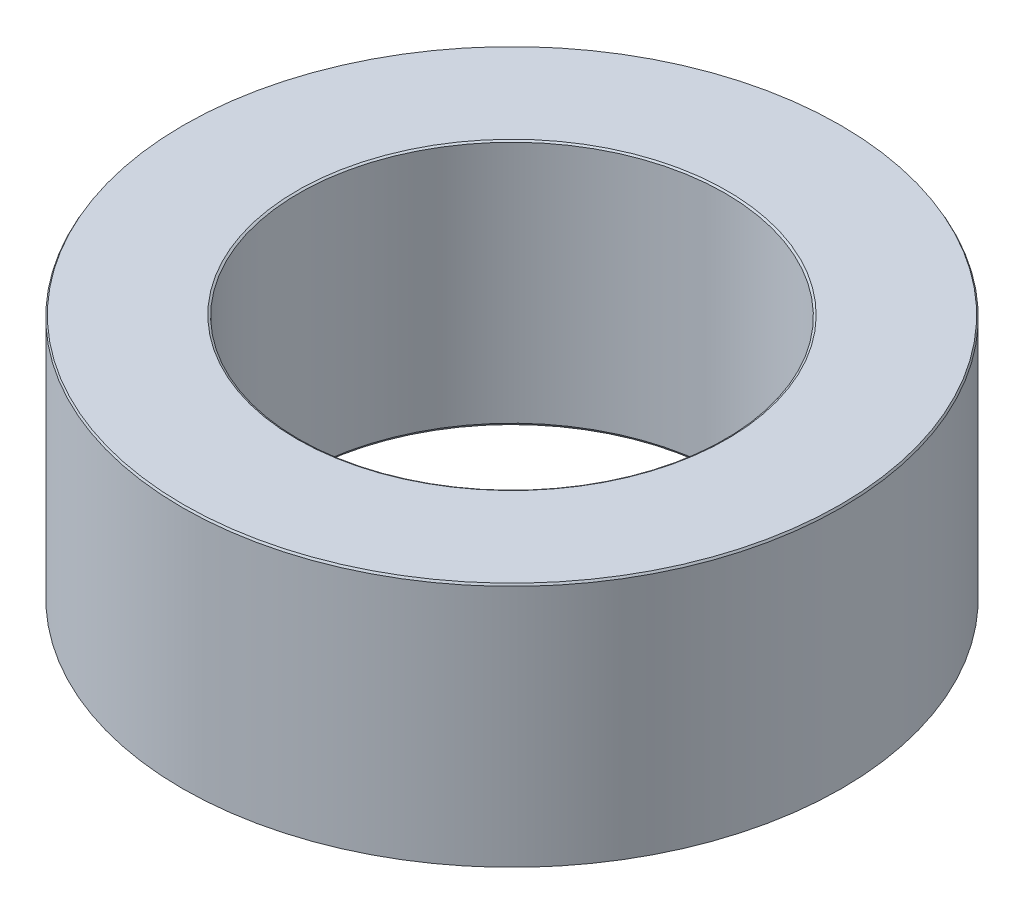
from build123d import *
from OCP.BRepFilletAPI import BRepFilletAPI_MakeChamfer

# Parameters (mm, degrees)
SKETCH1_R           = 57.5
BOSS_EXTRUDE1_DEPTH = 42.985384043
SKETCH2_R           = 37.166665849
CUT_EXTRUDE1_DEPTH  = 92.979580567
CHAMFER1_SIZE       = 0.346951986
CHAMFER1_SIZE2      = 0.200312822


with BuildPart() as part:
    # Sketch1 → Boss-Extrude1 (new body)
    with BuildSketch(Plane(origin=(0, 0, 0), x_dir=(1, 0, 0), z_dir=(0, 1, 0))):
        Circle(SKETCH1_R)
    extrude(amount=BOSS_EXTRUDE1_DEPTH)

    # Sketch2 → Cut-Extrude1 (cut, through all)
    with BuildSketch(Plane(origin=(0, 0, 0), x_dir=(1, 0, 0), z_dir=(0, 1, 0))):
        Circle(SKETCH2_R)
    extrude(amount=CUT_EXTRUDE1_DEPTH, mode=Mode.SUBTRACT)

    # Chamfer1: one chamfer whose edges measure the first distance from different faces: ONE call of the kernel's chamfer builder (chamfer() names one face for all edges)
    chamfer1_edges_1 = [part.edges().sort_by_distance(p)[0] for p in [
        (-37.166665849, 42.985384043, 0),
    ]]
    chamfer1_side_1 = [part.faces().sort_by_distance(p)[0] for p in [
        (-55.873654403, 42.985384043, 0),
    ]]
    chamfer1_edges_2 = [part.edges().sort_by_distance(p)[0] for p in [
        (-37.166665849, 0, 0),
    ]]
    chamfer1_side_2 = [part.faces().sort_by_distance(p)[0] for p in [
        (-37.166665849, 21.492692022, 0),
    ]]
    chamfer1_edges_3 = [part.edges().sort_by_distance(p)[0] for p in [
        (-57.5, 0, 0),
    ]]
    chamfer1_side_3 = [part.faces().sort_by_distance(p)[0] for p in [
        (-55.873654403, 0, 0),
    ]]
    chamfer1_edges_4 = [part.edges().sort_by_distance(p)[0] for p in [
        (-57.5, 42.985384043, 0),
    ]]
    chamfer1_side_4 = [part.faces().sort_by_distance(p)[0] for p in [
        (-57.5, 21.492692022, 0),
    ]]
    chamfer1 = BRepFilletAPI_MakeChamfer(part.part.solid().wrapped)
    for e in chamfer1_edges_1:
        chamfer1.Add(CHAMFER1_SIZE, CHAMFER1_SIZE2, e.wrapped, chamfer1_side_1[0].wrapped)  # the first distance lies on this face
    for e in chamfer1_edges_2:
        chamfer1.Add(CHAMFER1_SIZE, CHAMFER1_SIZE2, e.wrapped, chamfer1_side_2[0].wrapped)  # the first distance lies on this face
    for e in chamfer1_edges_3:
        chamfer1.Add(CHAMFER1_SIZE, CHAMFER1_SIZE2, e.wrapped, chamfer1_side_3[0].wrapped)  # the first distance lies on this face
    for e in chamfer1_edges_4:
        chamfer1.Add(CHAMFER1_SIZE, CHAMFER1_SIZE2, e.wrapped, chamfer1_side_4[0].wrapped)  # the first distance lies on this face
    add(Compound.cast(chamfer1.Shape()), mode=Mode.REPLACE)


solid = part.part
